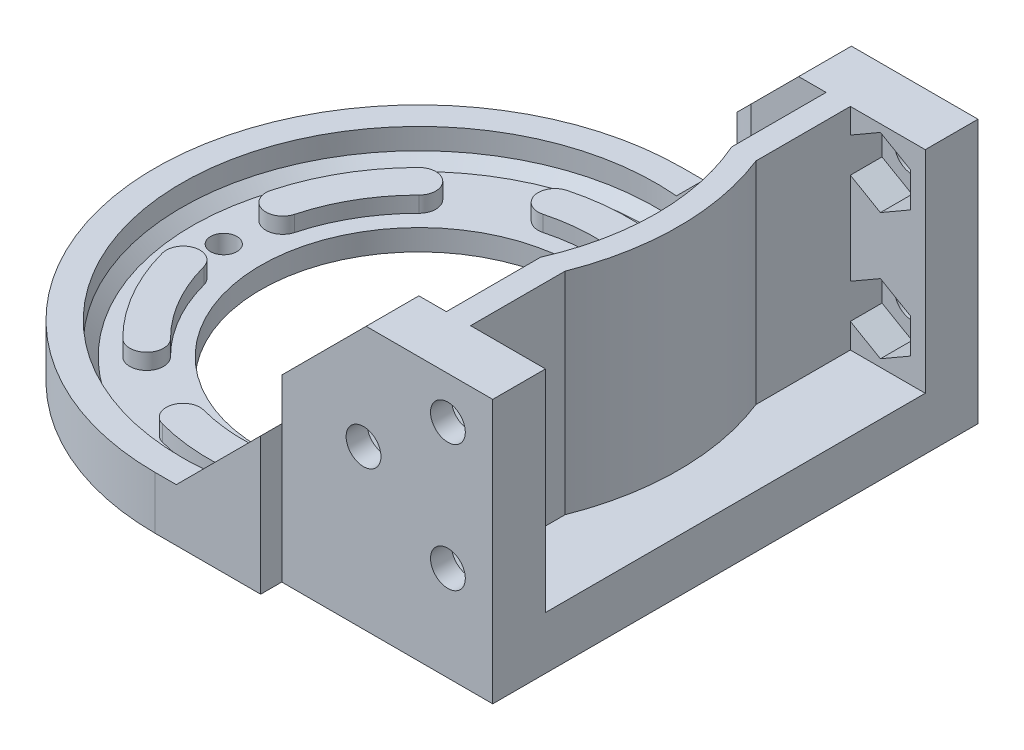
from build123d import *
from build123d.topology import SkipClean

# Parameters (mm, degrees)
SKETCH_1_R                      = 25
EXTRUDE_1_DEPTH                 = 5
CUT_EXTRUDE_1_REACH             = 37.707
SKETCH_2_R                      = 15
SKETCH_3_R                      = 22.5
CUT_EXTRUDE_2_DEPTH             = 3
CUT_EXTRUDE_3_REACH             = 37.482
SKETCH_4_R                      = 1.25
CHAMFER_1_SIZE                  = 1
EXTRUDE_2_DEPTH                 = 1.5
EXTRUDE_3_DEPTH                 = 5
CUT_EXTRUDE_4_REACH             = 41.37
SKETCH_10_W                     = 20
SKETCH_10_H                     = 2
EXTRUDE_START                   = 20
EXTRUDE_4_DEPTH                 = 20
CUT_EXTRUDE_5_REACH             = 60.086
SKETCH_11_R                     = 1.65
CUT_EXTRUDE_5_DIRECTION_2_DEPTH = 59.086142926
CUT_EXTRUDE_6_DEPTH             = 3
CHAMFER_4_SIZE                  = 8
EXTRUDE_8_DEPTH                 = 2
SKETCH_15_W                     = 2.3
SKETCH_15_H                     = 20
EXTRUDE_9_DEPTH                 = 36
CUT_EXTRUDE_8_REACH             = 48.368
SKETCH_14_R                     = 22.5
EXTRUDE_7_DEPTH                 = 20


# Read off the part's stored shape, not the designer's step: 镜向3
with BuildPart() as part:
    # 草图1 → 凸台-拉伸1 (new body)
    with BuildSketch(Plane(origin=(0, 0, 0), x_dir=(1, 0, 0), z_dir=(0, 1, 0))):
        with Locations(Location((0, 0, 0), (0, 0, 270))):
            Circle(SKETCH_1_R)
    extrude(amount=EXTRUDE_1_DEPTH)

    # 草图2 → 切除-拉伸1 (cut, up to next)
    with BuildSketch(Plane(origin=(0, 5, 0), x_dir=(1, 0, 0), z_dir=(0, 1, 0)), mode=Mode.PRIVATE) as cut_extrude_1_sk1:
        with Locations(Location((0, 0, 0), (0, 0, 270))):
            Circle(SKETCH_2_R)
    cut_extrude_1_tool1 = extrude(cut_extrude_1_sk1.sketch, amount=-CUT_EXTRUDE_1_REACH, mode=Mode.PRIVATE) & part.part
    add(cut_extrude_1_tool1.solids().sort_by_distance((0, 5, 0))[0], mode=Mode.SUBTRACT)

    # 草图3 → 切除-拉伸2 (cut)
    with BuildSketch(Plane(origin=(0, 5, 0), x_dir=(1, 0, 0), z_dir=(0, 1, 0))):
        with Locations(Location((0, 0, 0), (0, 0, 270))):
            Circle(SKETCH_3_R)
    extrude(amount=-CUT_EXTRUDE_2_DEPTH, mode=Mode.SUBTRACT)

    # 草图4 → 切除-拉伸3 (cut, up to next)
    with BuildSketch(Plane(origin=(0, 2, 0), x_dir=(1, 0, 0), z_dir=(0, 1, 0)), mode=Mode.PRIVATE) as cut_extrude_3_sk1:
        with Locations(Location((9.25, -16.02146997, 0), (0, 0, 270))):
            Circle(SKETCH_4_R)
    cut_extrude_3_tool1 = extrude(cut_extrude_3_sk1.sketch, amount=-CUT_EXTRUDE_3_REACH, mode=Mode.PRIVATE) & part.part
    # 草图4 → 切除-拉伸3 (cut, up to next)
    with BuildSketch(Plane(origin=(0, 2, 0), x_dir=(1, 0, 0), z_dir=(0, 1, 0)), mode=Mode.PRIVATE) as cut_extrude_3_sk2:
        with Locations(Location((-18.5, 0, 0), (0, 0, 270))):
            Circle(SKETCH_4_R)
    cut_extrude_3_tool2 = extrude(cut_extrude_3_sk2.sketch, amount=-CUT_EXTRUDE_3_REACH, mode=Mode.PRIVATE) & part.part
    # 草图4 → 切除-拉伸3 (cut, up to next)
    with BuildSketch(Plane(origin=(0, 2, 0), x_dir=(1, 0, 0), z_dir=(0, 1, 0)), mode=Mode.PRIVATE) as cut_extrude_3_sk3:
        with Locations(Location((9.25, 16.02146997, 0), (0, 0, 270))):
            Circle(SKETCH_4_R)
    cut_extrude_3_tool3 = extrude(cut_extrude_3_sk3.sketch, amount=-CUT_EXTRUDE_3_REACH, mode=Mode.PRIVATE) & part.part
    add(cut_extrude_3_tool1.solids().sort_by_distance((9.25, 2, 16.02147))[0], mode=Mode.SUBTRACT)
    add(cut_extrude_3_tool2.solids().sort_by_distance((-18.5, 2, 0))[0], mode=Mode.SUBTRACT)
    add(cut_extrude_3_tool3.solids().sort_by_distance((9.25, 2, -16.02147))[0], mode=Mode.SUBTRACT)

    # 倒角1
    chamfer_1_edges = [part.edges().sort_by_distance(p)[0] for p in [
        (0, 2, -22.5),
    ]]
    chamfer(chamfer_1_edges, length=CHAMFER_1_SIZE)

    # 草图7 → 凸台-拉伸2 (add)
    with BuildSketch(Plane(origin=(0, 2, 0), x_dir=(1, 0, 0), z_dir=(0, 1, 0))):
        with BuildLine():
            ThreePointArc((5.137558045, 19.173627652), (0, 19.85), (-5.137558045, 19.173627652))
            ThreePointArc((-5.137558045, 19.173627652), (-6.268928895, 17.214035858), (-4.309337101, 16.082665008))
            ThreePointArc((-4.309337101, 16.082665008), (0, 16.65), (4.309337101, 16.082665008))
            ThreePointArc((4.309337101, 16.082665008), (6.268928895, 17.214035858), (5.137558045, 19.173627652))
        make_face()
        with BuildLine():
            ThreePointArc((19.173627652, 5.137558045), (17.190604265, 9.925), (14.036069607, 14.036069607))
            ThreePointArc((14.036069607, 14.036069607), (11.773327907, 14.036069607), (11.773327907, 11.773327907))
            ThreePointArc((11.773327907, 11.773327907), (14.419322973, 8.325), (16.082665008, 4.309337101))
            ThreePointArc((16.082665008, 4.309337101), (18.042256802, 3.177966251), (19.173627652, 5.137558045))
        make_face()
        with BuildLine():
            ThreePointArc((14.036069607, -14.036069607), (17.190604265, -9.925), (19.173627652, -5.137558045))
            ThreePointArc((19.173627652, -5.137558045), (18.042256802, -3.177966251), (16.082665008, -4.309337101))
            ThreePointArc((16.082665008, -4.309337101), (14.419322973, -8.325), (11.773327907, -11.773327907))
            ThreePointArc((11.773327907, -11.773327907), (11.773327907, -14.036069607), (14.036069607, -14.036069607))
        make_face()
        with BuildLine():
            ThreePointArc((-5.137558045, -19.173627652), (0, -19.85), (5.137558045, -19.173627652))
            ThreePointArc((5.137558045, -19.173627652), (6.268928895, -17.214035858), (4.309337101, -16.082665008))
            ThreePointArc((4.309337101, -16.082665008), (0, -16.65), (-4.309337101, -16.082665008))
            ThreePointArc((-4.309337101, -16.082665008), (-6.268928895, -17.214035858), (-5.137558045, -19.173627652))
        make_face()
        with BuildLine():
            ThreePointArc((-19.173627652, -5.137558045), (-17.190604265, -9.925), (-14.036069607, -14.036069607))
            ThreePointArc((-14.036069607, -14.036069607), (-11.773327907, -14.036069607), (-11.773327907, -11.773327907))
            ThreePointArc((-11.773327907, -11.773327907), (-14.419322973, -8.325), (-16.082665008, -4.309337101))
            ThreePointArc((-16.082665008, -4.309337101), (-18.042256802, -3.177966251), (-19.173627652, -5.137558045))
        make_face()
        with BuildLine():
            ThreePointArc((-14.036069607, 14.036069607), (-17.190604265, 9.925), (-19.173627652, 5.137558045))
            ThreePointArc((-19.173627652, 5.137558045), (-18.042256802, 3.177966251), (-16.082665008, 4.309337101))
            ThreePointArc((-16.082665008, 4.309337101), (-14.419322973, 8.325), (-11.773327907, 11.773327907))
            ThreePointArc((-11.773327907, 11.773327907), (-11.773327907, 14.036069607), (-14.036069607, 14.036069607))
        make_face()
    extrude(amount=EXTRUDE_2_DEPTH)

    # 草图8 → 凸台-拉伸3 (add)
    with BuildSketch(Plane(origin=(0, 0, 0), x_dir=(1, 0, 0), z_dir=(0, 1, 0))):
        with BuildLine():
            Line((0, 25), (30, 25))
            Line((30, 25), (30, -25))
            Line((30, -25), (0, -25))
            ThreePointArc((0, -25), (25, 0), (0, 25))
        make_face()
    extrude(amount=EXTRUDE_3_DEPTH)

    # 草图10 → 切除-拉伸4 (cut, up to next)
    with BuildSketch(Plane(origin=(0, 5, 0), x_dir=(1, 0, 0), z_dir=(0, 1, 0)), mode=Mode.PRIVATE) as cut_extrude_4_sk1:
        with Locations((20, 24)):
            Rectangle(SKETCH_10_W, SKETCH_10_H)
    cut_extrude_4_tool1 = extrude(cut_extrude_4_sk1.sketch, amount=-CUT_EXTRUDE_4_REACH, mode=Mode.PRIVATE) & part.part
    add(cut_extrude_4_tool1.solids().sort_by_distance((20, 5, -24))[0], mode=Mode.SUBTRACT)

    # 草图9 → 凸台-拉伸4 (add)
    with SkipClean():  # the faces are left unmerged after this step: merging them gives an invalid solid
        with BuildSketch(Plane(origin=(0, 5, 0), x_dir=(1, 0, 0), z_dir=(0, 1, 0)).offset(EXTRUDE_START)):
            with BuildLine():
                Line((13.5, 18), (30, 18))
                Line((30, 18), (30, 23))
                Line((30, 23), (10, 23))
                Line((10, 23), (10, 20.155644371))
                ThreePointArc((10, 20.155644371), (11.799330518, 19.157917406), (13.5, 18))
            make_face()
        extrude(amount=-EXTRUDE_4_DEPTH)

    # 草图11 → 切除-拉伸5 (cut, up to next)
    with BuildSketch(Plane.XY.offset(-18), mode=Mode.PRIVATE) as cut_extrude_5_sk1:
        with Locations(Location((17.75, 15, 0), (0, 0, 180))):
            Circle(SKETCH_11_R)
    cut_extrude_5_tool1 = extrude(cut_extrude_5_sk1.sketch, amount=-CUT_EXTRUDE_5_REACH, mode=Mode.PRIVATE) & part.part
    # 草图11 → 切除-拉伸5 (cut, up to next)
    with BuildSketch(Plane.XY.offset(-18), mode=Mode.PRIVATE) as cut_extrude_5_sk2:
        with Locations(Location((25.75, 21, 0), (0, 0, 180))):
            Circle(SKETCH_11_R)
    cut_extrude_5_tool2 = extrude(cut_extrude_5_sk2.sketch, amount=-CUT_EXTRUDE_5_REACH, mode=Mode.PRIVATE) & part.part
    # 草图11 → 切除-拉伸5 (cut, up to next)
    with BuildSketch(Plane.XY.offset(-18), mode=Mode.PRIVATE) as cut_extrude_5_sk3:
        with Locations(Location((25.75, 9, 0), (0, 0, 180))):
            Circle(SKETCH_11_R)
    cut_extrude_5_tool3 = extrude(cut_extrude_5_sk3.sketch, amount=-CUT_EXTRUDE_5_REACH, mode=Mode.PRIVATE) & part.part
    add(cut_extrude_5_tool1.solids().sort_by_distance((17.75, 15, -18))[0], mode=Mode.SUBTRACT)
    add(cut_extrude_5_tool2.solids().sort_by_distance((25.75, 21, -18))[0], mode=Mode.SUBTRACT)
    add(cut_extrude_5_tool3.solids().sort_by_distance((25.75, 9, -18))[0], mode=Mode.SUBTRACT)

    # 草图11 → 切除-拉伸5 direction 2 (cut)
    with SkipClean():  # the faces are left unmerged after this step: merging them gives an invalid solid
        with BuildSketch(Plane.XY.offset(-18)):
            with Locations(Location((17.75, 15, 0), (0, 0, 180))):
                Circle(SKETCH_11_R)
            with Locations(Location((25.75, 21, 0), (0, 0, 180))):
                Circle(SKETCH_11_R)
            with Locations(Location((25.75, 9, 0), (0, 0, 180))):
                Circle(SKETCH_11_R)
        extrude(amount=CUT_EXTRUDE_5_DIRECTION_2_DEPTH, mode=Mode.SUBTRACT)

    # 草图12 → 切除-拉伸6 (cut)
    with SkipClean():  # the faces are left unmerged after this step: merging them gives an invalid solid
        with BuildSketch(Plane.XY.offset(-18)):
            Polygon((28.6, 22.645448267), (25.75, 24.290896534), (22.9, 22.645448267), (22.9, 19.354551733), (25.75, 17.709103466), (28.6, 19.354551733), align=None)
            Polygon((28.6, 10.645448267), (25.75, 12.290896534), (22.9, 10.645448267), (22.9, 7.354551733), (25.75, 5.709103466), (28.6, 7.354551733), align=None)
            Polygon((20.6, 16.645448267), (17.75, 18.290896534), (14.9, 16.645448267), (14.9, 13.354551733), (17.75, 11.709103466), (20.6, 13.354551733), align=None)
        extrude(amount=-CUT_EXTRUDE_6_DEPTH, mode=Mode.SUBTRACT)

    # 倒角4
    # the kernel refuses this chamfer: 8 mm, written as the material it adds along each edge
    with BuildSketch(Plane(origin=(10, 5, -23), x_dir=(-0.9996219169112968, -0.02749587661058638, 0), z_dir=(0, 0, 1))) as chamfer_4_piece_1_section:
        Polygon((CHAMFER_4_SIZE * 0.999621916911, -CHAMFER_4_SIZE * 0.0274958766106), (-CHAMFER_4_SIZE * 0.0274958766106, -CHAMFER_4_SIZE * 0.999621916911), (0, 0), align=None)
    chamfer_4_piece_1 = extrude(amount=23.417819533, mode=Mode.PRIVATE)
    chamfer_4_piece_1 = chamfer_4_piece_1 - Plane(origin=(0, 7.978966695, 0), x_dir=(0, 0, 1), z_dir=(0, 1, 0)) * Cylinder(22.5, 79, mode=Mode.PRIVATE)
    add(chamfer_4_piece_1)
    # the kernel refuses this chamfer: 8 mm, written as the material it takes off along each edge
    with BuildSketch(Plane(origin=(10, 25, -43.573463904), x_dir=(-0.02749587661058627, -0.9996219169112968, 0), z_dir=(0, 0, 1))) as chamfer_4_2_piece_1:
        Polygon((CHAMFER_4_SIZE * 0.999621916911, CHAMFER_4_SIZE * 0.0274958766106), (-CHAMFER_4_SIZE * 0.0274958766106, CHAMFER_4_SIZE * 0.999621916911), (0, 0), align=None)
    extrude(amount=43.991283437, mode=Mode.SUBTRACT)

    # 草图17 → 凸台-拉伸8 (add)
    with BuildSketch(Plane(origin=(0, 0, -23), x_dir=(-1, 0, 0), z_dir=(0, 0, -1))):
        Polygon((-10, 13), (-10, 5), (-2, 5), align=None)
    extrude(amount=EXTRUDE_8_DEPTH)

    # 镜向3
    split(bisect_by=Plane.XY, keep=Keep.BOTTOM)

    # Mirror 3 2: part across plane


with BuildPart() as part_1:
    add(part.part)
    add(part.part.mirror(Plane.XY))

    # 草图15 → 凸台-拉伸9 (add)
    with BuildSketch(Plane.XY.offset(-18)):
        with Locations((21.75, 15)):
            Rectangle(SKETCH_15_W, SKETCH_15_H)
    extrude(amount=EXTRUDE_9_DEPTH)

    # 草图14 → 切除-拉伸8 (cut, up to next)
    with BuildSketch(Plane(origin=(0, 25, 0), x_dir=(1, 0, 0), z_dir=(0, 1, 0)), mode=Mode.PRIVATE) as cut_extrude_8_sk1:
        with Locations(Location((0, 0, 0), (0, 0, 270))):
            Circle(SKETCH_14_R)
    cut_extrude_8_tool1 = extrude(cut_extrude_8_sk1.sketch, amount=-CUT_EXTRUDE_8_REACH, mode=Mode.PRIVATE) & part_1.part
    add(cut_extrude_8_tool1.solids().sort_by_distance((0, 25, 0))[0], mode=Mode.SUBTRACT)

    # 草图16 → 凸台-拉伸7 (add)
    with BuildSketch(Plane(origin=(0, 5, 0), x_dir=(1, 0, 0), z_dir=(0, 1, 0))):
        with BuildLine():
            Line((22.9, 9.049309366), (22.9, -9.049309366))
            ThreePointArc((22.9, -9.049309366), (24.62315983, 0), (22.9, 9.049309366))
        make_face()
    extrude(amount=EXTRUDE_7_DEPTH)


solid = part_1.part
